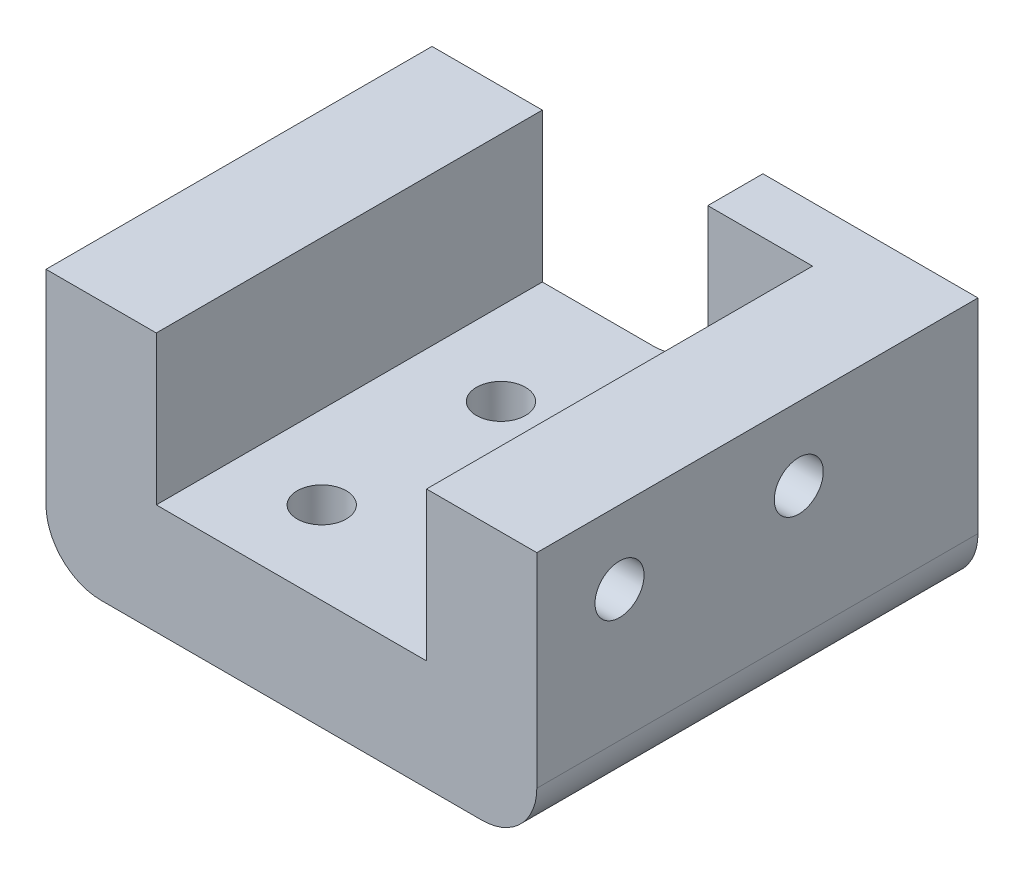
from build123d import *

# Parameters (mm, degrees)
BOSS_EXTRUDE1_DEPTH = 2
SKETCH2_W           = 2
SKETCH2_H           = 7
BOSS_EXTRUDE2_DEPTH = 2.7
SKETCH3_R           = 0.4445
CUT_EXTRUDE1_DEPTH  = 10.052623929
SKETCH5_W           = 3.9
SKETCH5_H           = 4.7
BOSS_EXTRUDE3_DEPTH = 1
FILLET1_R           = 1
SKETCH6_R           = 0.4445
CUT_EXTRUDE2_DEPTH  = 9.100655838
FILLET2_R           = 1


with BuildPart() as part:
    # Sketch1 → Boss-Extrude1 (new body)
    with BuildSketch(Plane(origin=(0, 0, 0), x_dir=(1, 0, 0), z_dir=(0, 1, 0))):
        Polygon((2.075, -3.5), (2.825, -3.5), (3.825, -3.5), (4.825, -3.5), (4.825, 3.5), (3.825, 3.5), (2.825, 3.5), (2.075, 3.5), (-2.075, 3.5), (-4.075, 3.5), (-4.075, -3.5), (-2.075, -3.5), align=None)
    extrude(amount=BOSS_EXTRUDE1_DEPTH)

    # Sketch2 → Boss-Extrude2 (add)
    with BuildSketch(Plane(origin=(0, 2, 0), x_dir=(1, 0, 0), z_dir=(0, 1, 0))):
        with Locations((-3.075, 0)):
            Rectangle(SKETCH2_W, SKETCH2_H)
        with Locations((3.825, 0)):
            Rectangle(SKETCH2_W, SKETCH2_H)
    extrude(amount=BOSS_EXTRUDE2_DEPTH)

    # Sketch3 → Cut-Extrude1 (cut, through all)
    with BuildSketch(Plane.ZY.offset(-2.825)):
        with Locations((-1.25, 3.375)):
            Circle(SKETCH3_R)
        with Locations((2, 3.375)):
            Circle(SKETCH3_R)
    extrude(amount=-CUT_EXTRUDE1_DEPTH, mode=Mode.SUBTRACT)

    # Sketch5 → Boss-Extrude3 (add)
    with BuildSketch(Plane(origin=(0, 0, -3.5), x_dir=(-1, 0, 0), z_dir=(0, 0, -1))):
        with Locations((-2.875, 2.35)):
            Rectangle(SKETCH5_W, SKETCH5_H)
    extrude(amount=BOSS_EXTRUDE3_DEPTH)

    # Fillet1
    fillet1_edges = [part.edges().sort_by_distance(p)[0] for p in [
        (0.925, 1, -3.5),
    ]]
    fillet(fillet1_edges, radius=FILLET1_R - 0.0001)  # a hair under: the kernel refuses the full size

    # Sketch6 → Cut-Extrude2 (cut, through all)
    with BuildSketch(Plane.XZ):
        with Locations(Location((-0.575, 2, 0), (0, 0, 270))):
            Circle(SKETCH6_R)
        with Locations(Location((-0.575, -1.25, 0), (0, 0, 270))):
            Circle(SKETCH6_R)
    extrude(amount=-CUT_EXTRUDE2_DEPTH, mode=Mode.SUBTRACT)

    # Fillet2
    fillet2_edges = [part.edges().sort_by_distance(p)[0] for p in [
        (4.825, 0, -0.5),
        (-4.075, 0, 0),
    ]]
    fillet(fillet2_edges, radius=FILLET2_R)


solid = part.part
